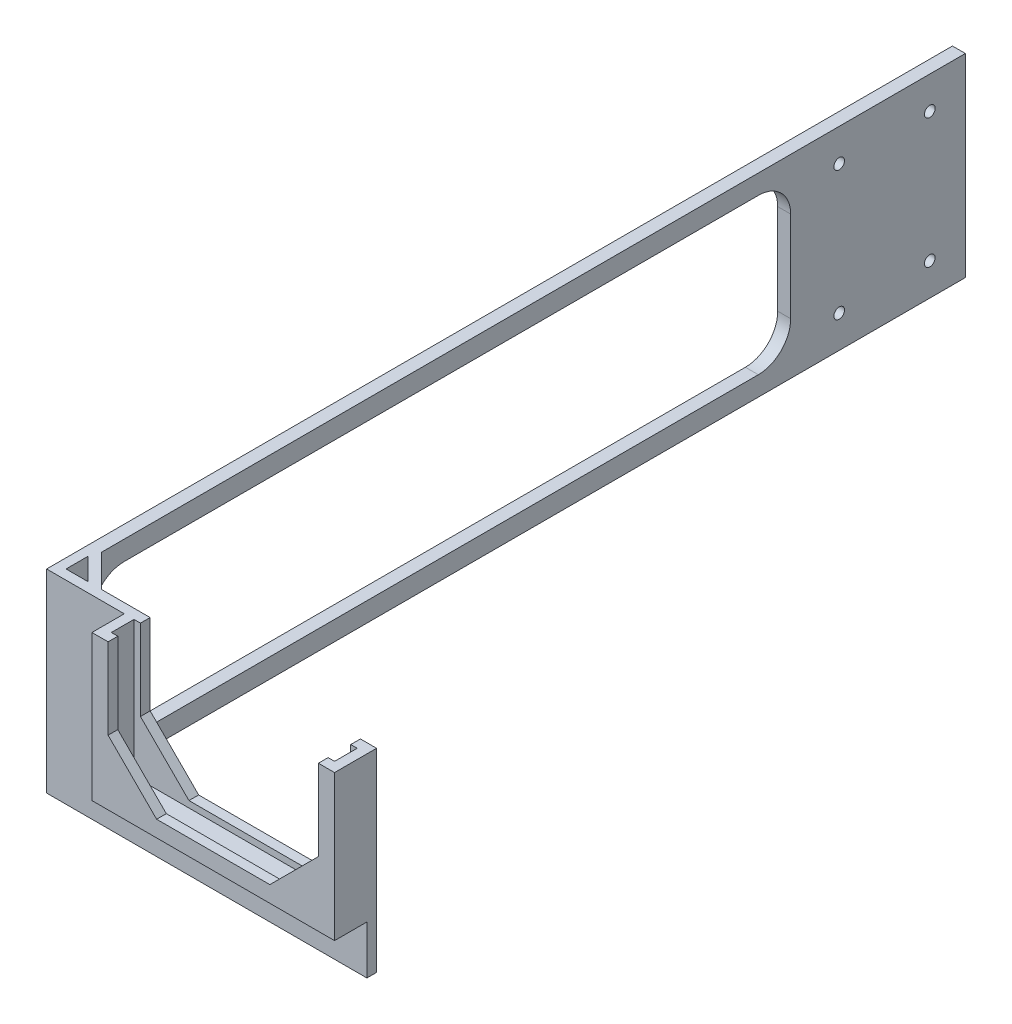
from build123d import *

# Parameters (mm, degrees)
SKETCH_1_W          = 280
SKETCH_1_H          = 60
EXTRUDE_1_DEPTH     = 4
HOLE_WIZARD_M4_1_D  = 3.3
SKETCH_10_W         = 3
SKETCH_10_H         = 60
EXTRUDE_4_DEPTH     = 95
EXTRUDE_8_DEPTH     = 60
SKETCH_14_W         = 75
SKETCH_14_H         = 45
EXTRUDE_10_DEPTH    = 10
SHELL_START         = -12
SHELL_1_OUTLINE_W   = 69
SHELL_1_OUTLINE_H   = 7
SHELL_1_DEPTH       = 42
SHELL_START_2       = -27
SHELL_1_2_DEPTH     = 15
CUT_EXTRUDE_2_REACH = 309.898
CUT_EXTRUDE_3_REACH = 184.211


# Read off the part's stored shape, not the designer's step: 抽壳1
with BuildPart() as part:
    # 草图1 → 凸台-拉伸1 (new body)
    with BuildSketch(Plane(origin=(0, 0, 0), x_dir=(0, 0, -1), z_dir=(1, 0, 0))):
        Rectangle(SKETCH_1_W, SKETCH_1_H)
    extrude(amount=EXTRUDE_1_DEPTH)

    # M4 螺纹孔1 (through all)
    with Locations(Plane(origin=(4, 20, -129), x_dir=(0, 0, 1), z_dir=(1, 0, 0))):
        with Locations((0, 0), (28, 0), (28, 40), (0, 40)):
            Hole(HOLE_WIZARD_M4_1_D / 2)

    # 草图10 → 凸台-拉伸4 (add)
    with BuildSketch(Plane(origin=(4, 0, 0), x_dir=(0, 0, -1), z_dir=(1, 0, 0))):
        with Locations((-138.5, 0)):
            Rectangle(SKETCH_10_W, SKETCH_10_H)
    extrude(amount=EXTRUDE_4_DEPTH)

    # 草图11 → 凸台-拉伸8 (add)
    with BuildSketch(Plane(origin=(0, 30, 0), x_dir=(1, 0, 0), z_dir=(0, 1, 0))):
        Polygon((4, -127), (14, -137), (4, -137), align=None)
    extrude(amount=-EXTRUDE_8_DEPTH)

    # 草图14 → 凸台-拉伸10 (add)
    with BuildSketch(Plane.XY.offset(140)):
        with Locations((61.5, 7.5)):
            Rectangle(SKETCH_14_W, SKETCH_14_H)
    extrude(amount=EXTRUDE_10_DEPTH)

    # 抽壳1 outline → 抽壳1 (cut)
    with BuildSketch(Plane(origin=(0, 0, 0), x_dir=(1, 0, 0), z_dir=(0, 1, 0)).offset(SHELL_START)):
        with Locations((61.5, -143.5)):
            Rectangle(SHELL_1_OUTLINE_W, SHELL_1_OUTLINE_H)
        Polygon((3, -137), (9.757359313, -137), (3, -130.242640687), align=None)
    extrude(amount=SHELL_1_DEPTH, mode=Mode.SUBTRACT)

    # Shell 1 2 outline → Shell 1 2 (cut)
    with BuildSketch(Plane(origin=(0, 0, 0), x_dir=(1, 0, 0), z_dir=(0, 1, 0)).offset(SHELL_START_2)):
        Polygon((3, -137), (9.757359313, -137), (3, -130.242640687), align=None)
    extrude(amount=SHELL_1_2_DEPTH, mode=Mode.SUBTRACT)

    # 切除-拉伸2: up to this face of the body (flat: up to its plane)
    cut_extrude_2_end = Plane(part.part.faces().sort_by_distance((56.5, 0, 137))[0])
    # 草图15 → 切除-拉伸2 (cut, up to the picked face)
    with BuildSketch(Plane.XY.offset(150), mode=Mode.PRIVATE) as cut_extrude_2_sk1:
        Polygon((61.5, 30), (29, 30), (29, 5), (44, -10), (61.5, -10), align=None)
    cut_extrude_2_tool1 = split(extrude(cut_extrude_2_sk1.sketch, amount=-CUT_EXTRUDE_2_REACH, mode=Mode.PRIVATE), bisect_by=cut_extrude_2_end, keep=Keep.BOTH, mode=Mode.PRIVATE)
    # 草图15 → 切除-拉伸2 (cut, up to the picked face)
    with BuildSketch(Plane.XY.offset(150), mode=Mode.PRIVATE) as cut_extrude_2_sk2:
        Polygon((94, 30), (61.5, 30), (61.5, -10), (79, -10), (94, 5), align=None)
    cut_extrude_2_tool2 = split(extrude(cut_extrude_2_sk2.sketch, amount=-CUT_EXTRUDE_2_REACH, mode=Mode.PRIVATE), bisect_by=cut_extrude_2_end, keep=Keep.BOTH, mode=Mode.PRIVATE)
    add(cut_extrude_2_tool1.solids().sort_by(Axis((46.315789, 11.421053, 150), (0, 0, -1)))[0], mode=Mode.SUBTRACT)
    add(cut_extrude_2_tool2.solids().sort_by(Axis((76.684211, 11.421053, 150), (0, 0, -1)))[0], mode=Mode.SUBTRACT)

    # 草图16 → 切除-拉伸3 (cut, up to next)
    with BuildSketch(Plane.ZY, mode=Mode.PRIVATE) as cut_extrude_3_sk1:
        with BuildLine():
            Line((-76, 24), (120, 24))
            ThreePointArc((120, 24), (127.071067812, 21.071067812), (130, 14))
            Line((130, 14), (130, -14))
            ThreePointArc((130, -14), (127.071067812, -21.071067812), (120, -24))
            Line((120, -24), (-76, -24))
            ThreePointArc((-76, -24), (-83.071067812, -21.071067812), (-86, -14))
            Line((-86, -14), (-86, 14))
            ThreePointArc((-86, 14), (-83.071067812, 21.071067812), (-76, 24))
        make_face()
    cut_extrude_3_tool1 = extrude(cut_extrude_3_sk1.sketch, amount=-CUT_EXTRUDE_3_REACH, mode=Mode.PRIVATE) & part.part
    add(cut_extrude_3_tool1.solids().sort_by_distance((0, 0, 22))[0], mode=Mode.SUBTRACT)


solid = part.part
